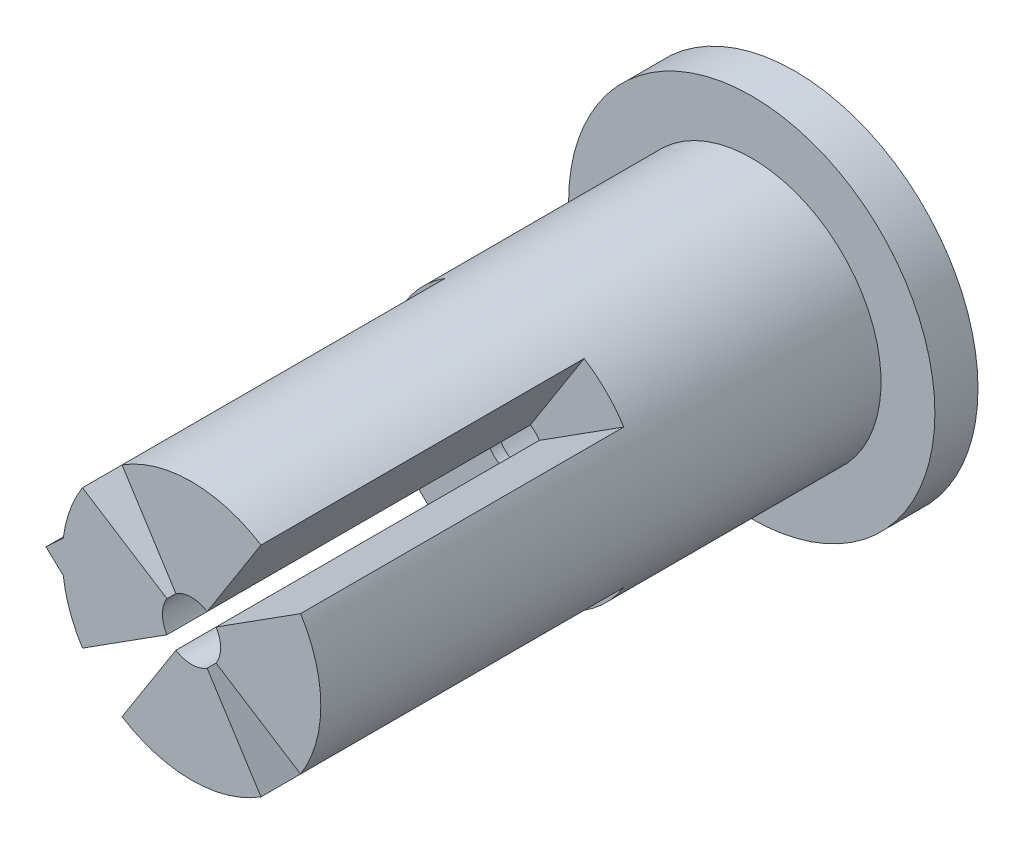
from build123d import *

# Parameters (mm, degrees)
BOSS_EXTRUDE1_DEPTH      = 13
BOSS_EXTRUDE1_DEPTH_BACK = 13
CUT_EXTRUDE1_REACH       = 29.525
SKETCH2_R                = 1.35
SKETCH3_R                = 8.5
BOSS_EXTRUDE2_DEPTH      = 2
CUT_EXTRUDE2_DEPTH       = 12.5
CUT_EXTRUDE3_DEPTH       = 15


with BuildPart() as part:
    # Sketch1 → Boss-Extrude1 (new, two sides: drawn at the far end of the back side and taken through both)
    with BuildSketch(Plane.XY.offset(-BOSS_EXTRUDE1_DEPTH_BACK)):
        with BuildLine():
            Line((-5.95294045, 0.75), (-6.75294045, 0))
            Line((-6.75294045, 0), (-5.95294045, -0.75))
            ThreePointArc((-5.95294045, -0.75), (6, 0), (-5.95294045, 0.75))
        make_face()
    extrude(amount=BOSS_EXTRUDE1_DEPTH + BOSS_EXTRUDE1_DEPTH_BACK)

    # Sketch2 → Cut-Extrude1 (cut, up to next)
    with BuildSketch(Plane.XY.offset(13), mode=Mode.PRIVATE) as cut_extrude1_sk1:
        Circle(SKETCH2_R)
    cut_extrude1_tool1 = extrude(cut_extrude1_sk1.sketch, amount=-CUT_EXTRUDE1_REACH, mode=Mode.PRIVATE) & part.part
    add(cut_extrude1_tool1.solids().sort_by_distance((0, 0, 13))[0], mode=Mode.SUBTRACT)

    # Sketch3 → Boss-Extrude2 (add)
    with BuildSketch(Plane(origin=(0, 0, -13), x_dir=(-1, 0, 0), z_dir=(0, 0, -1))):
        Circle(SKETCH3_R)
    extrude(amount=BOSS_EXTRUDE2_DEPTH)

    # Sketch4 → Cut-Extrude2 (cut)
    with BuildSketch(Plane(origin=(0, 0, -15), x_dir=(-1, 0, 0), z_dir=(0, 0, -1))):
        with BuildLine():
            Line((2.5, 1.833030278), (2.5, -1.833030278))
            ThreePointArc((2.5, -1.833030278), (-3.1, 0), (2.5, 1.833030278))
        make_face()
    extrude(amount=-CUT_EXTRUDE2_DEPTH, mode=Mode.SUBTRACT)

    # Sketch5 → Cut-Extrude3 (cut)
    with BuildSketch(Plane.XY.offset(13)):
        with BuildLine():
            Line((-1.138578452, 0.725354471), (-5.060348675, 3.22379765))
            ThreePointArc((-5.060348675, 3.22379765), (-4.242640687, 4.242640687), (-3.22379765, 5.060348675))
            Line((-3.22379765, 5.060348675), (-0.725354471, 1.138578452))
            ThreePointArc((-0.725354471, 1.138578452), (-0.954594155, 0.954594155), (-1.138578452, 0.725354471))
        make_face()
        with BuildLine():
            Line((0.725354471, 1.138578452), (3.22379765, 5.060348675))
            ThreePointArc((3.22379765, 5.060348675), (4.242640687, 4.242640687), (5.060348675, 3.22379765))
            Line((5.060348675, 3.22379765), (1.138578452, 0.725354471))
            ThreePointArc((1.138578452, 0.725354471), (0.954594155, 0.954594155), (0.725354471, 1.138578452))
        make_face()
        with BuildLine():
            Line((1.138578452, -0.725354471), (5.060348675, -3.22379765))
            ThreePointArc((5.060348675, -3.22379765), (4.242640687, -4.242640687), (3.22379765, -5.060348675))
            Line((3.22379765, -5.060348675), (0.725354471, -1.138578452))
            ThreePointArc((0.725354471, -1.138578452), (0.954594155, -0.954594155), (1.138578452, -0.725354471))
        make_face()
        with BuildLine():
            Line((-0.725354471, -1.138578452), (-3.22379765, -5.060348675))
            ThreePointArc((-3.22379765, -5.060348675), (-4.242640687, -4.242640687), (-5.060348675, -3.22379765))
            Line((-5.060348675, -3.22379765), (-1.138578452, -0.725354471))
            ThreePointArc((-1.138578452, -0.725354471), (-0.954594155, -0.954594155), (-0.725354471, -1.138578452))
        make_face()
    extrude(amount=-CUT_EXTRUDE3_DEPTH, mode=Mode.SUBTRACT)


solid = part.part
